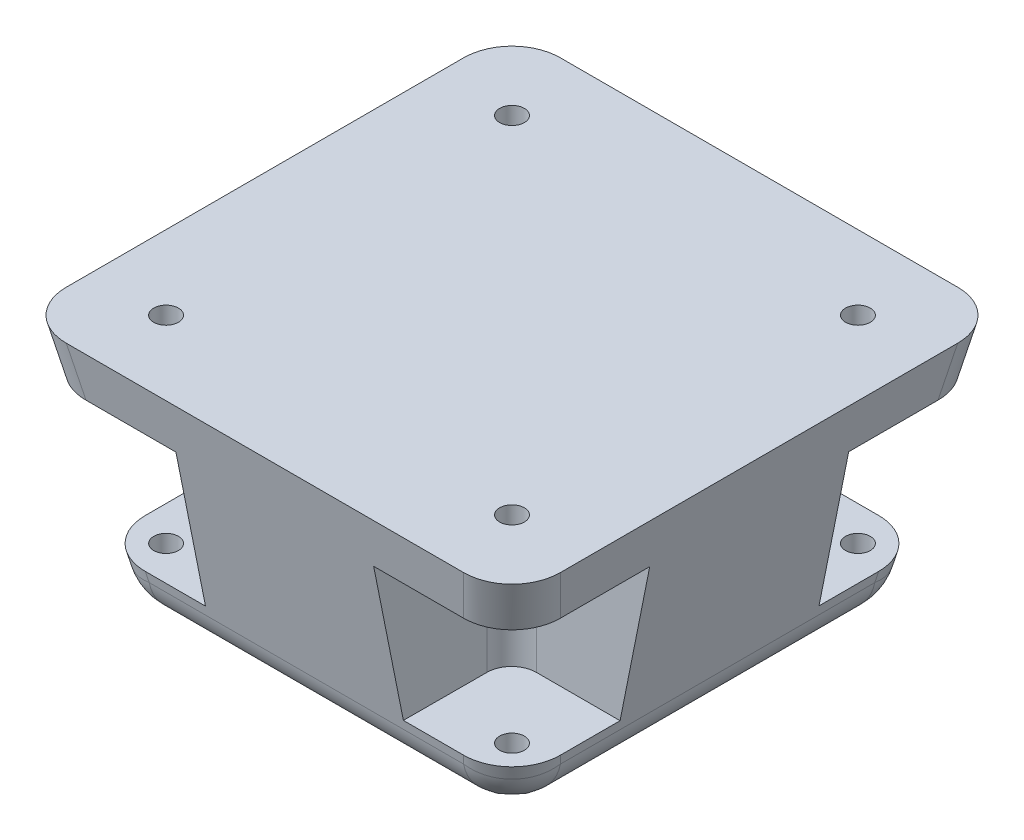
from build123d import *

# Parameters (mm, degrees)
SKETCH2_W               = 1000
SKETCH2_H               = 1000
BOSS_EXTRUDE1_DEPTH     = 500
CUT_EXTRUDE1_DEPTH      = 1225.744871392
CUT_EXTRUDE1_DEPTH_BACK = 1225.744871392
SKETCH4_OUTSIDE_W       = 1302
SKETCH4_OUTSIDE_H       = 802
CUT_EXTRUDE2_DEPTH      = 867.025403784
CUT_EXTRUDE2_DEPTH_BACK = 867.025403784
SKETCH6_OUTSIDE_W       = 1302
SKETCH6_OUTSIDE_H       = 802
FILLET1_R               = 100
CUT_EXTRUDE4_DEPTH      = 150
SKETCH11_OUTSIDE_W      = 1302
SKETCH11_OUTSIDE_H      = 1302
SKETCH11_OUTSIDE_W_2    = 1000
SKETCH11_OUTSIDE_H_2    = 1000
SKETCH11_OUTSIDE_R      = 25
CUT_EXTRUDE5_DEPTH      = 867.025403784


with BuildPart() as part:
    # Sketch2 → Boss-Extrude1 (new body)
    with BuildSketch(Plane(origin=(0, 0, 0), x_dir=(1, 0, 0), z_dir=(0, 1, 0))):
        Rectangle(SKETCH2_W, SKETCH2_H)
    extrude(amount=BOSS_EXTRUDE1_DEPTH)

    # Sketch4 outside → Cut-Extrude1 (cut, two sides: drawn at the far end of the back side and taken through both)
    with BuildSketch(Plane.XY.offset(500).offset(-CUT_EXTRUDE1_DEPTH_BACK)):
        with Locations((0, 250)):
            Rectangle(SKETCH4_OUTSIDE_W, SKETCH4_OUTSIDE_H)
        Polygon((-400, 0), (400, 0), (500, 500), (-500, 500), align=None, mode=Mode.SUBTRACT)
    extrude(amount=CUT_EXTRUDE1_DEPTH + CUT_EXTRUDE1_DEPTH_BACK, mode=Mode.SUBTRACT)

    # Sketch6 outside → Cut-Extrude2 (cut, two sides: drawn at the far end of the back side and taken through both)
    with BuildSketch(Plane(origin=(0, 0, 0), x_dir=(0, 0, -1), z_dir=(1, 0, 0)).offset(-CUT_EXTRUDE2_DEPTH_BACK)):
        with Locations((0, 250)):
            Rectangle(SKETCH6_OUTSIDE_W, SKETCH6_OUTSIDE_H)
        Polygon((-400, 0), (400, 0), (500, 500), (-500, 500), align=None, mode=Mode.SUBTRACT)
    extrude(amount=CUT_EXTRUDE2_DEPTH + CUT_EXTRUDE2_DEPTH_BACK, mode=Mode.SUBTRACT)

    # Fillet1
    fillet1_edges = [part.edges().sort_by_distance(p)[0] for p in [
        (0, 0, 400),
        (0, 0, -400),
        (-450, 250, 450),
        (-450, 250, -450),
        (-400, 0, 0),
        (400, 0, 0),
        (450, 250, 450),
        (450, 250, -450),
    ]]
    fillet(fillet1_edges, radius=FILLET1_R)

    # Sketch8 → Cut-Extrude4 (cut, symmetric)
    with BuildSketch(Plane(origin=(0, 250, 0), x_dir=(1, 0, 0), z_dir=(0, 1, 0))):
        with BuildLine():
            Line((-500, -201.300848081), (-250.648904569, -201.300848081))
            ThreePointArc((-250.648904569, -201.300848081), (-215.339467732, -215.899666319), (-200.649072912, -251.171101273))
            Line((-200.649072912, -251.171101273), (-200, -501.300848081))
            Line((-200, -501.300848081), (-500, -501.300848081))
            Line((-500, -501.300848081), (-500, -201.300848081))
        make_face()
        with BuildLine():
            Line((500, -201.300848081), (500, -501.300848081))
            Line((500, -501.300848081), (200, -501.300848081))
            Line((200, -501.300848081), (200.649072912, -251.171101273))
            ThreePointArc((200.649072912, -251.171101273), (215.339467732, -215.899666319), (250.648904569, -201.300848081))
            Line((250.648904569, -201.300848081), (500, -201.300848081))
        make_face()
        with BuildLine():
            Line((500, 201.300848081), (250.648904569, 201.300848081))
            ThreePointArc((250.648904569, 201.300848081), (215.339467732, 215.899666319), (200.649072912, 251.171101273))
            Line((200.649072912, 251.171101273), (200, 501.300848081))
            Line((200, 501.300848081), (500, 501.300848081))
            Line((500, 501.300848081), (500, 201.300848081))
        make_face()
        with BuildLine():
            Line((-500, 201.300848081), (-500, 501.300848081))
            Line((-500, 501.300848081), (-200, 501.300848081))
            Line((-200, 501.300848081), (-200.649072912, 251.171101273))
            ThreePointArc((-200.649072912, 251.171101273), (-215.339467732, 215.899666319), (-250.648904569, 201.300848081))
            Line((-250.648904569, 201.300848081), (-500, 201.300848081))
        make_face()
    extrude(amount=CUT_EXTRUDE4_DEPTH, both=True, mode=Mode.SUBTRACT)

    # Sketch11 outside → Cut-Extrude5 (cut, through all)
    # profile 1 of 5: a face of its own
    with BuildSketch(Plane.XZ):
        Rectangle(SKETCH11_OUTSIDE_W, SKETCH11_OUTSIDE_H)
        Rectangle(SKETCH11_OUTSIDE_W_2, SKETCH11_OUTSIDE_H_2, mode=Mode.SUBTRACT)
    # profile 2 of 5: a face of its own
    with BuildSketch(Plane.XZ):
        with Locations((-350, 350)):
            Circle(SKETCH11_OUTSIDE_R)
    # profile 3 of 5: a face of its own
    with BuildSketch(Plane.XZ):
        with Locations((350, 350)):
            Circle(SKETCH11_OUTSIDE_R)
    # profile 4 of 5: a face of its own
    with BuildSketch(Plane.XZ):
        with Locations((350, -350)):
            Circle(SKETCH11_OUTSIDE_R)
    # profile 5 of 5: a face of its own
    with BuildSketch(Plane.XZ):
        with Locations((-350, -350)):
            Circle(SKETCH11_OUTSIDE_R)
    extrude(amount=-CUT_EXTRUDE5_DEPTH, mode=Mode.SUBTRACT)


solid = part.part
